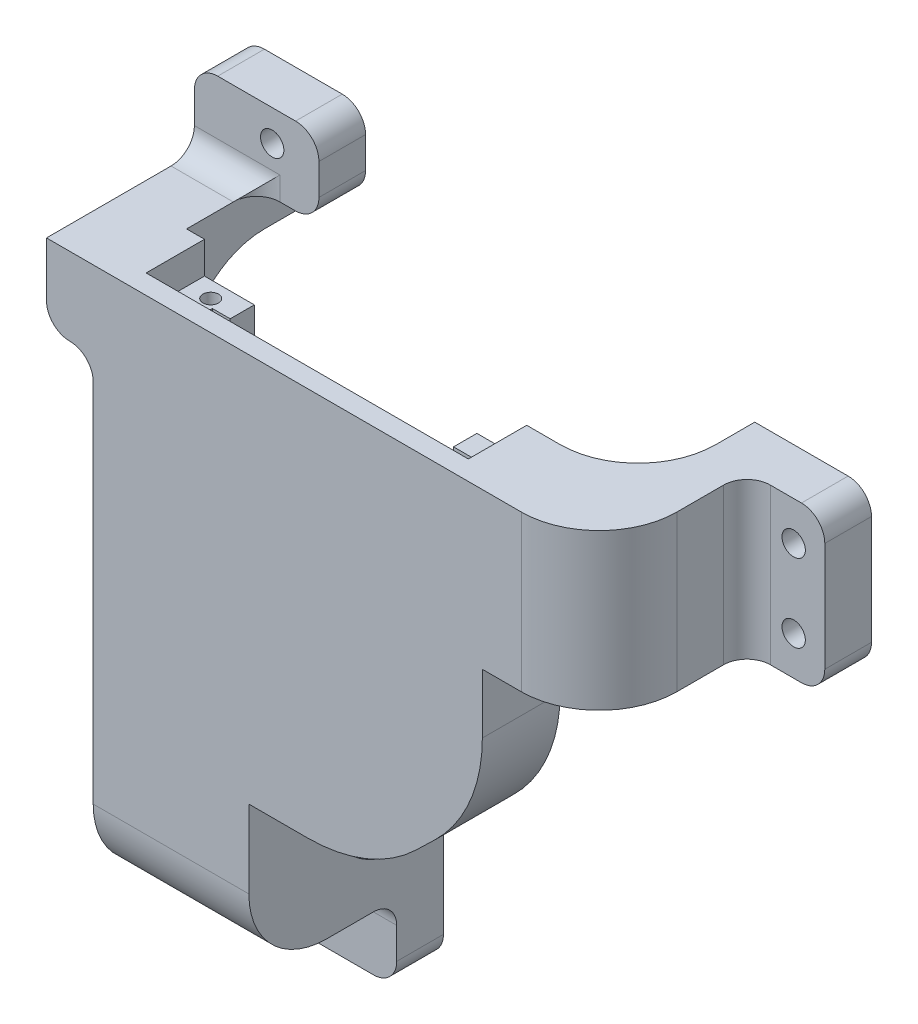
from build123d import *

# Parameters (mm, degrees)
SKETCH1_W                = 10
SKETCH1_H                = 20
BOSS_EXTRUDE2_DEPTH      = 10
SKETCH3_W                = 10
SKETCH3_H                = 20
BOSS_EXTRUDE3_DEPTH      = 10
SKETCH4_W                = 62.5
SKETCH4_H                = 5
BOSS_EXTRUDE4_DEPTH      = 10
SKETCH6_R                = 1
CUT_EXTRUDE1_DEPTH       = 10
CUT_EXTRUDE3_START       = -10
SKETCH10_R               = 1
CUT_EXTRUDE3_DEPTH       = 10
SKETCH11_W               = 50
SKETCH11_H               = 50
BOSS_EXTRUDE8_DEPTH      = 10
SKETCH18_W               = 10
SKETCH18_H               = 10
BOSS_EXTRUDE9_DEPTH      = 6
SKETCH20_W               = 10
SKETCH20_H               = 10
BOSS_EXTRUDE10_DEPTH     = 12
SKETCH23_W               = 28.6
SKETCH23_H               = 45
CUT_EXTRUDE10_DEPTH      = 7.5
SKETCH24_W               = 6.4
SKETCH24_H               = 7.5
CUT_EXTRUDE11_DEPTH      = 4.1
SKETCH25_W               = 2.3
SKETCH25_H               = 2.5
CUT_EXTRUDE12_DEPTH      = 39
SKETCH26_W               = 2.3
SKETCH26_H               = 2.4
CUT_EXTRUDE13_DEPTH      = 41
SKETCH27_R               = 1
CUT_EXTRUDE14_DEPTH      = 10
SKETCH28_R               = 1
CUT_EXTRUDE15_DEPTH      = 10
SKETCH31_W               = 12.5
SKETCH31_H               = 10
BOSS_EXTRUDE11_DEPTH     = 5
SKETCH32_W               = 10
SKETCH32_H               = 10
CUT_EXTRUDE16_DEPTH      = 7.5
CUT_EXTRUDE17_DEPTH      = 7.5
SKETCH33_W               = 10
SKETCH33_H               = 10
BOSS_EXTRUDE12_DEPTH     = 5
SKETCH34_W               = 10
SKETCH34_H               = 10
BOSS_EXTRUDE13_DEPTH     = 5
SKETCH35_W               = 10
SKETCH35_H               = 10
BOSS_EXTRUDE14_DEPTH     = 3.5
SKETCH36_W               = 10
SKETCH36_H               = 10
BOSS_EXTRUDE15_DEPTH     = 9.5
CUT_EXTRUDE18_DEPTH      = 90.5
CUT_EXTRUDE18_DEPTH_BACK = 15.5
SKETCH37_R               = 1.25
CUT_EXTRUDE19_DEPTH      = 88.5
CUT_EXTRUDE19_DEPTH_BACK = 15.5
SKETCH38_R               = 1.25
SKETCH39_W               = 29.967126749
SKETCH39_H               = 31.835751001
SKETCH39_W_2             = 15.617210398
SKETCH39_H_2             = 32.298255859
CUT_EXTRUDE20_DEPTH      = 36
SKETCH40_W               = 10
SKETCH40_H               = 10
BOSS_EXTRUDE16_DEPTH     = 6
SKETCH41_W               = 20
SKETCH41_H               = 10
BOSS_EXTRUDE17_DEPTH     = 20
SKETCH43_W               = 10
SKETCH43_H               = 20
BOSS_EXTRUDE18_DEPTH     = 15
SKETCH44_W               = 5
SKETCH44_H               = 20
SKETCH44_W_2             = 20
SKETCH44_H_2             = 5
SKETCH44_W_3             = 8
BOSS_EXTRUDE19_DEPTH     = 13
SKETCH45_W               = 15
SKETCH45_H               = 20
SKETCH45_W_2             = 20
SKETCH45_H_2             = 15
SKETCH45_W_3             = 8
BOSS_EXTRUDE20_DEPTH     = 4
SKETCH49_W               = 8
SKETCH49_H               = 15
SKETCH49_W_2             = 20
SKETCH49_W_3             = 15
SKETCH49_H_2             = 20
BOSS_EXTRUDE21_DEPTH     = 2
SKETCH47_R               = 1.5
CUT_EXTRUDE22_DEPTH      = 10
FILLET1_R                = 3
FILLET2_R                = 10
CUT_EXTRUDE23_DEPTH      = 10
FILLET3_R                = 20
FILLET7_R                = 3
FILLET8_R                = 3
SKETCH50_W               = 6
SKETCH50_H               = 10
BOSS_EXTRUDE22_DEPTH     = 8
SKETCH46_R               = 1.5
CUT_EXTRUDE21_DEPTH      = 10
FILLET10_R               = 3


with BuildPart() as part:
    # Sketch1 → Boss-Extrude2 (new body)
    with BuildSketch(Plane(origin=(0, 0, 0), x_dir=(1, 0, 0), z_dir=(0, 1, 0))):
        with Locations((5, 10)):
            Rectangle(SKETCH1_W, SKETCH1_H)
    extrude(amount=BOSS_EXTRUDE2_DEPTH)



with BuildPart() as body_2:
    # Sketch3 → Boss-Extrude3 (new body)
    with BuildSketch(Plane(origin=(0, 0, 0), x_dir=(1, 0, 0), z_dir=(0, 1, 0))):
        with Locations((77.5, 10)):
            Rectangle(SKETCH3_W, SKETCH3_H)
    extrude(amount=BOSS_EXTRUDE3_DEPTH)


with BuildPart() as part_1:
    add(part.part)

    add(body_2.part)  # Boss-Extrude4 merges body 2
    # Sketch4 → Boss-Extrude4 (add)
    with BuildSketch(Plane(origin=(0, 0, 0), x_dir=(1, 0, 0), z_dir=(0, 1, 0))):
        with Locations((41.25, 10)):
            Rectangle(SKETCH4_W, SKETCH4_H)
    extrude(amount=BOSS_EXTRUDE4_DEPTH)

    # Sketch6 → Cut-Extrude1 (cut)
    with BuildSketch(Plane(origin=(10, 0, 0), x_dir=(0, 0, -1), z_dir=(1, 0, 0))):
        with Locations((16.25, 5)):
            Circle(SKETCH6_R)
    extrude(amount=-CUT_EXTRUDE1_DEPTH, mode=Mode.SUBTRACT)

    # Sketch10 → Cut-Extrude3 (cut)
    with BuildSketch(Plane.ZY.offset(-72.5).offset(CUT_EXTRUDE3_START)):
        with Locations(Location((-16.25, 5, 0), (0, 0, 180))):
            Circle(SKETCH10_R)
    extrude(amount=CUT_EXTRUDE3_DEPTH, mode=Mode.SUBTRACT)

    # Sketch11 → Boss-Extrude8 (add)
    with BuildSketch(Plane(origin=(0, 0, -12.5), x_dir=(-1, 0, 0), z_dir=(0, 0, -1))):
        with Locations((-35, 20)):
            Rectangle(SKETCH11_W, SKETCH11_H)
    extrude(amount=-BOSS_EXTRUDE8_DEPTH)

    # Sketch18 → Boss-Extrude9 (add)
    with BuildSketch(Plane.XY):
        with Locations((5, 5)):
            Rectangle(SKETCH18_W, SKETCH18_H)
    extrude(amount=BOSS_EXTRUDE9_DEPTH)

    # Sketch20 → Boss-Extrude10 (add)
    with BuildSketch(Plane.XZ):
        with Locations((77.5, -7.5)):
            Rectangle(SKETCH20_W, SKETCH20_H)
        with Locations((5, -7.5)):
            Rectangle(SKETCH20_W, SKETCH20_H)
    extrude(amount=BOSS_EXTRUDE10_DEPTH)

    # Sketch23 → Cut-Extrude10 (cut)
    with BuildSketch(Plane(origin=(0, 0, -12.5), x_dir=(-1, 0, 0), z_dir=(0, 0, -1))):
        with Locations((-35, 22.5)):
            Rectangle(SKETCH23_W, SKETCH23_H)
    extrude(amount=-CUT_EXTRUDE10_DEPTH, mode=Mode.SUBTRACT)

    # Sketch24 → Cut-Extrude11 (cut)
    with BuildSketch(Plane(origin=(0, 45, 0), x_dir=(1, 0, 0), z_dir=(0, 1, 0))):
        with Locations((17.5, 8.75)):
            Rectangle(SKETCH24_W, SKETCH24_H)
        with Locations((52.5, 8.75)):
            Rectangle(SKETCH24_W, SKETCH24_H)
    extrude(amount=-CUT_EXTRUDE11_DEPTH, mode=Mode.SUBTRACT)

    # Sketch25 → Cut-Extrude12 (cut)
    with BuildSketch(Plane(origin=(0, 40.9, 0), x_dir=(1, 0, 0), z_dir=(0, 1, 0))):
        with Locations((50.45, 8.25)):
            Rectangle(SKETCH25_W, SKETCH25_H)
    extrude(amount=-CUT_EXTRUDE12_DEPTH, mode=Mode.SUBTRACT)

    # Sketch26 → Cut-Extrude13 (cut)
    with BuildSketch(Plane(origin=(0, 40.9, 0), x_dir=(1, 0, 0), z_dir=(0, 1, 0))):
        with Locations((19.55, 8.2)):
            Rectangle(SKETCH26_W, SKETCH26_H)
    extrude(amount=-CUT_EXTRUDE13_DEPTH, mode=Mode.SUBTRACT)

    # Sketch27 → Cut-Extrude14 (cut)
    with BuildSketch(Plane(origin=(0, 40.9, 0), x_dir=(1, 0, 0), z_dir=(0, 1, 0))):
        with Locations(Location((17.2, 10.4, 0), (0, 0, 270))):
            Circle(SKETCH27_R)
    extrude(amount=-CUT_EXTRUDE14_DEPTH, mode=Mode.SUBTRACT)

    # Sketch28 → Cut-Extrude15 (cut)
    with BuildSketch(Plane(origin=(0, 40.9, 0), x_dir=(1, 0, 0), z_dir=(0, 1, 0))):
        with Locations(Location((52.8, 10.4, 0), (0, 0, 270))):
            Circle(SKETCH28_R)
    extrude(amount=-CUT_EXTRUDE15_DEPTH, mode=Mode.SUBTRACT)

    # Sketch31 → Boss-Extrude11 (add)
    with BuildSketch(Plane.XY.offset(-7.5)):
        with Locations((66.25, 5)):
            Rectangle(SKETCH31_W, SKETCH31_H)
    extrude(amount=BOSS_EXTRUDE11_DEPTH)

    # Sketch32 → Cut-Extrude16 (cut)
    with BuildSketch(Plane(origin=(0, 0, -20), x_dir=(-1, 0, 0), z_dir=(0, 0, -1))):
        with Locations((-77.5, 5)):
            Rectangle(SKETCH32_W, SKETCH32_H)
    extrude(amount=-CUT_EXTRUDE16_DEPTH, mode=Mode.SUBTRACT)

    # 3DSketch1 → Cut-Extrude17 (cut)
    with BuildSketch(Plane(origin=(10, 0, -20), x_dir=(-0.7071067811865476, 0.7071067811865476, 0), z_dir=(0, 0, 1))):
        Polygon((0, 0), (7.071067812, 7.071067812), (14.142135624, 0), (7.071067812, -7.071067812), align=None)
    extrude(amount=CUT_EXTRUDE17_DEPTH, mode=Mode.SUBTRACT)

    # Sketch33 → Boss-Extrude12 (add)
    with BuildSketch(Plane.XZ.offset(12)):
        with Locations((5, -7.5)):
            Rectangle(SKETCH33_W, SKETCH33_H)
    extrude(amount=BOSS_EXTRUDE12_DEPTH)

    # Sketch34 → Boss-Extrude13 (add)
    with BuildSketch(Plane.XZ.offset(12)):
        with Locations((77.5, -7.5)):
            Rectangle(SKETCH34_W, SKETCH34_H)
    extrude(amount=BOSS_EXTRUDE13_DEPTH)

    # Sketch35 → Boss-Extrude14 (add)
    with BuildSketch(Plane.XY.offset(6)):
        with Locations((5, 5)):
            Rectangle(SKETCH35_W, SKETCH35_H)
    extrude(amount=BOSS_EXTRUDE14_DEPTH)

    # Sketch36 → Boss-Extrude15 (add)
    with BuildSketch(Plane.XY):
        with Locations((77.5, 5)):
            Rectangle(SKETCH36_W, SKETCH36_H)
    extrude(amount=BOSS_EXTRUDE15_DEPTH)

    # Sketch37 → Cut-Extrude18 (cut, two sides: drawn at the far end of the back side and taken through both)
    with BuildSketch(Plane(origin=(10, 0, 0), x_dir=(0, 0, -1), z_dir=(1, 0, 0)).offset(-CUT_EXTRUDE18_DEPTH_BACK)):
        with Locations(Location((-3.5, 5, 0), (0, 0, 180))):
            Circle(SKETCH37_R)
    extrude(amount=CUT_EXTRUDE18_DEPTH + CUT_EXTRUDE18_DEPTH_BACK, mode=Mode.SUBTRACT)

    # Sketch38 → Cut-Extrude19 (cut, two sides: drawn at the far end of the back side and taken through both)
    with BuildSketch(Plane(origin=(10, 0, 0), x_dir=(0, 0, -1), z_dir=(1, 0, 0)).offset(-CUT_EXTRUDE19_DEPTH_BACK)):
        with Locations(Location((7.5, -11, 0), (0, 0, 180))):
            Circle(SKETCH38_R)
    extrude(amount=CUT_EXTRUDE19_DEPTH + CUT_EXTRUDE19_DEPTH_BACK, mode=Mode.SUBTRACT)

    # Sketch39 → Cut-Extrude20 (cut)
    with BuildSketch(Plane(origin=(0, 0, -12.5), x_dir=(-1, 0, 0), z_dir=(0, 0, -1))):
        with Locations((-74.983563375, -4.30748393)):
            Rectangle(SKETCH39_W, SKETCH39_H)
        with Locations((-2.191394801, -3.536642501)):
            Rectangle(SKETCH39_W_2, SKETCH39_H_2)
    extrude(amount=-CUT_EXTRUDE20_DEPTH, mode=Mode.SUBTRACT)

    # Sketch40 → Boss-Extrude16 (add)
    with BuildSketch(Plane.ZY.offset(-10)):
        with Locations((-7.5, 40)):
            Rectangle(SKETCH40_W, SKETCH40_H)
    extrude(amount=BOSS_EXTRUDE16_DEPTH)

    # Sketch41 → Boss-Extrude17 (add)
    with BuildSketch(Plane.XZ.offset(5)):
        with Locations((20, -7.5)):
            Rectangle(SKETCH41_W, SKETCH41_H)
    extrude(amount=BOSS_EXTRUDE17_DEPTH)

    # Sketch43 → Boss-Extrude18 (add)
    with BuildSketch(Plane(origin=(60, 0, 0), x_dir=(0, 0, -1), z_dir=(1, 0, 0))):
        with Locations((7.5, 35)):
            Rectangle(SKETCH43_W, SKETCH43_H)
    extrude(amount=BOSS_EXTRUDE18_DEPTH)

    # Sketch44 → Boss-Extrude19 (add)
    with BuildSketch(Plane(origin=(0, 0, -12.5), x_dir=(-1, 0, 0), z_dir=(0, 0, -1))):
        with Locations((-72.5, 35)):
            Rectangle(SKETCH44_W, SKETCH44_H)
        with Locations((-20, -22.5)):
            Rectangle(SKETCH44_W_2, SKETCH44_H_2)
        with Locations((-8, 42.5)):
            Rectangle(SKETCH44_W_3, SKETCH44_H_2)
    extrude(amount=BOSS_EXTRUDE19_DEPTH)

    # Sketch45 → Boss-Extrude20 (add)
    with BuildSketch(Plane(origin=(0, 0, -25.5), x_dir=(-1, 0, 0), z_dir=(0, 0, -1))):
        with Locations((-77.5, 35)):
            Rectangle(SKETCH45_W, SKETCH45_H)
        with Locations((-20, -27.5)):
            Rectangle(SKETCH45_W_2, SKETCH45_H_2)
        with Locations((-8, 47.5)):
            Rectangle(SKETCH45_W_3, SKETCH45_H_2)
    extrude(amount=-BOSS_EXTRUDE20_DEPTH)

    # Sketch49 → Boss-Extrude21 (add)
    with BuildSketch(Plane(origin=(0, 0, -25.5), x_dir=(-1, 0, 0), z_dir=(0, 0, -1))):
        with Locations((-8, 47.5)):
            Rectangle(SKETCH49_W, SKETCH49_H)
        with Locations((-20, -27.5)):
            Rectangle(SKETCH49_W_2, SKETCH49_H)
        with Locations((-77.5, 35)):
            Rectangle(SKETCH49_W_3, SKETCH49_H_2)
    extrude(amount=BOSS_EXTRUDE21_DEPTH)

    # Sketch47 → Cut-Extrude22 (cut)
    with BuildSketch(Plane.XY.offset(-21.5)):
        with Locations((15, -31)):
            Circle(SKETCH47_R)
        with Locations((81, 30)):
            Circle(SKETCH47_R)
        with Locations((81, 40)):
            Circle(SKETCH47_R)
    extrude(amount=-CUT_EXTRUDE22_DEPTH, mode=Mode.SUBTRACT)

    # Fillet1
    fillet1_edges = [part_1.edges().sort_by_distance(p)[0] for p in [
        (20, -25, -21.5),
        (8, 45, -21.5),
        (75, 35, -21.5),
    ]]
    fillet(fillet1_edges, radius=FILLET1_R)

    # Fillet2
    fillet2_edges = [part_1.edges().sort_by_distance(p)[0] for p in [
        (8, 40, -12.5),
        (20, -20, -12.5),
        (20, -25, -2.5),
        (75, 35, -2.5),
        (70, 35, -12.5),
    ]]
    fillet(fillet2_edges, radius=FILLET2_R)

    # Sketch48 → Cut-Extrude23 (cut)
    with BuildSketch(Plane(origin=(0, 0, -12.5), x_dir=(-1, 0, 0), z_dir=(0, 0, -1))):
        Polygon((-41.126439375, -9.370767462), (-66.809029943, 15.441226815), (-67.788450769, -8.064873027), align=None)
    extrude(amount=-CUT_EXTRUDE23_DEPTH, mode=Mode.SUBTRACT)

    # Fillet3
    fillet3_edges = [part_1.edges().sort_by_distance(p)[0] for p in [
        (60, 8.863011447, -7.5),
        (45.650567099, -5, -7.5),
    ]]
    fillet(fillet3_edges, radius=FILLET3_R)

    # Fillet7
    fillet7_edges = [part_1.edges().sort_by_distance(p)[0] for p in [
        (10, 35, -8.169872981),
        (4, 35, -8.169872981),
    ]]
    fillet(fillet7_edges, radius=FILLET7_R - 0.0001)  # a hair under: the kernel refuses the full size

    # Fillet8
    fillet8_edges = [part_1.edges().sort_by_distance(p)[0] for p in [
        (85, 45, -24.5),
        (85, 25, -24.5),
        (30, -35, -24.5),
        (10, -35, -24.5),
        (4, 55, -24.5),
    ]]
    fillet(fillet8_edges, radius=FILLET8_R)

    # Sketch50 → Boss-Extrude22 (add)
    with BuildSketch(Plane(origin=(12, 0, 0), x_dir=(0, 0, -1), z_dir=(1, 0, 0))):
        with Locations((24.5, 50)):
            Rectangle(SKETCH50_W, SKETCH50_H)
    extrude(amount=BOSS_EXTRUDE22_DEPTH)

    # Sketch46 → Cut-Extrude21 (cut)
    with BuildSketch(Plane.XY.offset(-21.5)):
        with Locations((14, 51)):
            Circle(SKETCH46_R)
    extrude(amount=-CUT_EXTRUDE21_DEPTH, mode=Mode.SUBTRACT)

    # Fillet10
    fillet10_edges = [part_1.edges().sort_by_distance(p)[0] for p in [
        (12, 46.5, -21.5),
        (20, 45, -24.5),
        (20, 55, -24.5),
    ]]
    fillet(fillet10_edges, radius=FILLET10_R - 0.0001)  # a hair under: the kernel refuses the full size


solid = part_1.part
